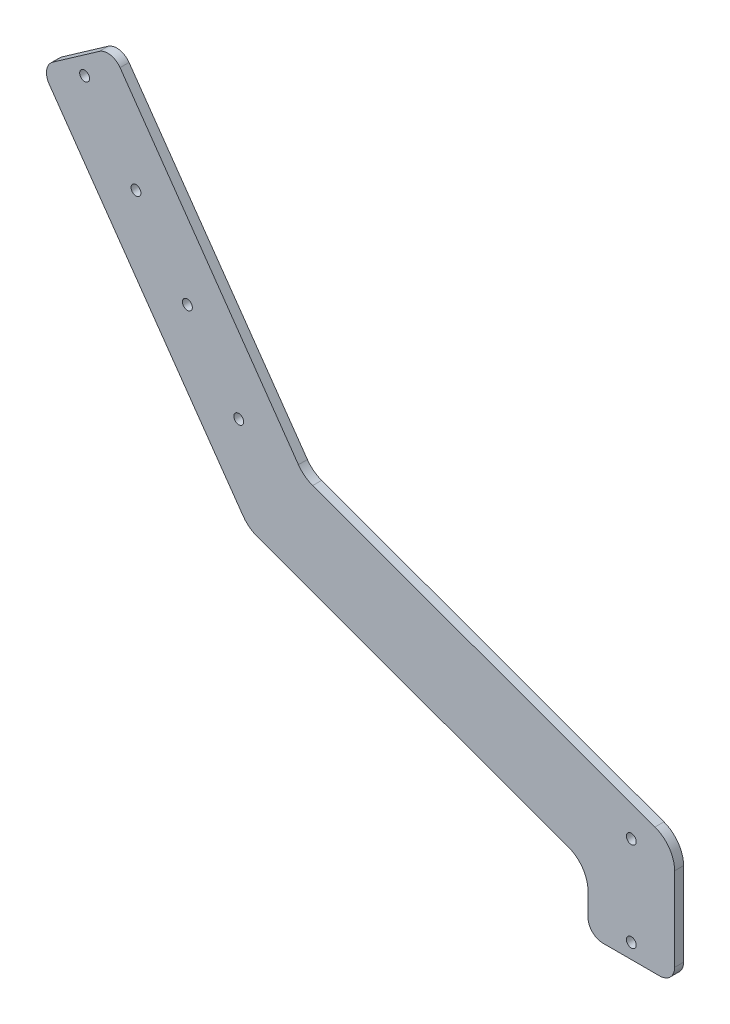
from build123d import *

# Parameters (mm, degrees)
SKETCH_1_R      = 1.65
EXTRUDE_1_DEPTH = 3
FILLET_1_R      = 10
FILLET_2_R      = 5


with BuildPart() as part:
    # 草图1 → 凸台-拉伸1 (new body)
    with BuildSketch(Plane.XY):
        Polygon((-14.5, -5), (14.5, -5), (14.5, 35), (-109.652000503, 80.187632708), (-174.042829775, 172.147267185), (-197.798239059, 155.513550531), (-128.162819072, 56.063864277), (-14.5, 14.693981392), align=None)
        Circle(SKETCH_1_R, mode=Mode.SUBTRACT)
        with Locations((0, 30)):
            Circle(SKETCH_1_R, mode=Mode.SUBTRACT)
        with Locations((-183.052652235, 159.734648636)):
            Circle(SKETCH_1_R, mode=Mode.SUBTRACT)
        with Locations((-165.845359145, 135.160087308)):
            Circle(SKETCH_1_R, mode=Mode.SUBTRACT)
        with Locations((-148.638066054, 110.585525979)):
            Circle(SKETCH_1_R, mode=Mode.SUBTRACT)
        with Locations((-131.430772964, 86.01096465)):
            Circle(SKETCH_1_R, mode=Mode.SUBTRACT)
    extrude(amount=EXTRUDE_1_DEPTH)

    # 圆角1
    fillet_1_edges = [part.edges().sort_by_distance(p)[0] for p in [
        (-14.5, 14.693981392, 1.5),
        (-109.652000503, 80.187632708, 1.5),
        (14.5, 35, 1.5),
        (-128.162819072, 56.063864277, 1.5),
    ]]
    fillet(fillet_1_edges, radius=FILLET_1_R)

    # 圆角2
    fillet_2_edges = [part.edges().sort_by_distance(p)[0] for p in [
        (14.5, -5, 1.5),
        (-14.5, -5, 1.5),
        (-174.042829775, 172.147267185, 1.5),
        (-197.798239059, 155.513550531, 1.5),
    ]]
    fillet(fillet_2_edges, radius=FILLET_2_R)


solid = part.part
